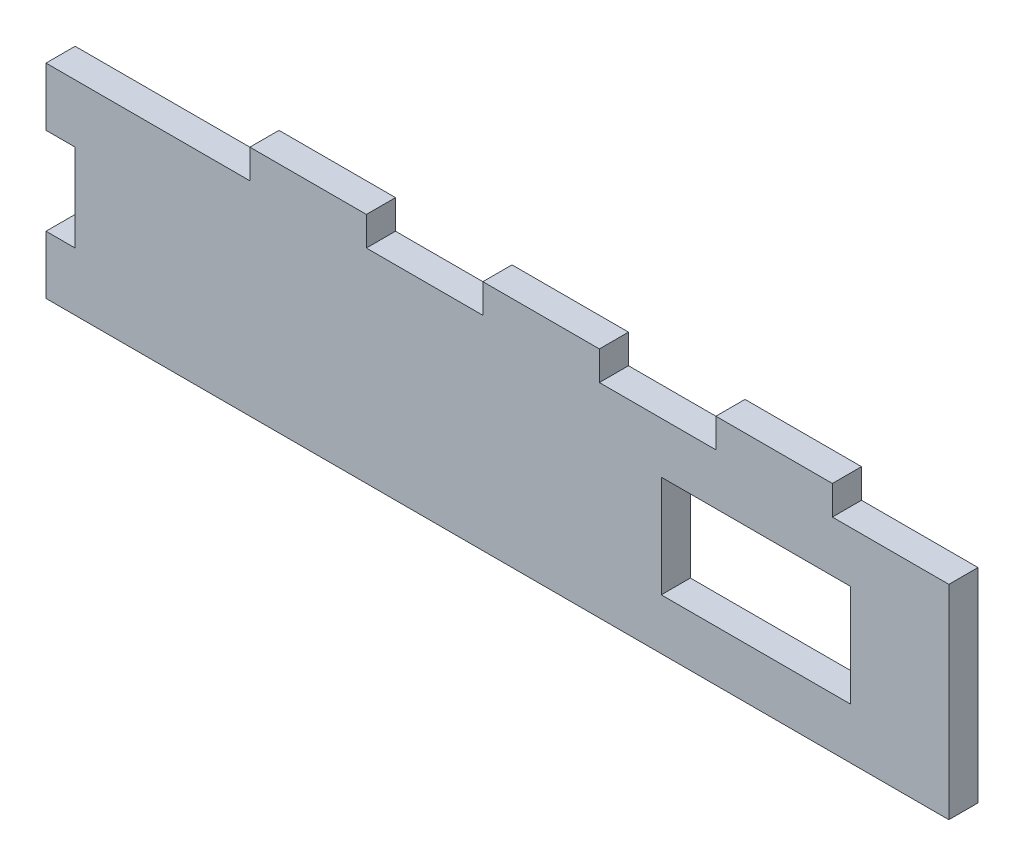
from build123d import *

# Parameters (mm, degrees)
SKETCH1_W           = 190.5
SKETCH1_H           = 44.45
BOSS_EXTRUDE1_DEPTH = 6.35
SKETCH2_W           = 41.275
SKETCH2_H           = 22.225
CUT_EXTRUDE1_DEPTH  = 151.221931202
SKETCH3_W           = 25.4
SKETCH3_H           = 6.35
BOSS_EXTRUDE2_DEPTH = 6.35
LPATTERN1_COUNT     = 3
LPATTERN1_PITCH     = 50.8
SKETCH4_W           = 6.35
SKETCH4_H           = 12.7
BOSS_EXTRUDE3_DEPTH = 6.35
LPATTERN2_COUNT     = 2
LPATTERN2_PITCH     = 31.75


with BuildPart() as part:
    # Sketch1 → Boss-Extrude1 (new body)
    with BuildSketch(Plane.XY):
        with Locations((-53.183, 0)):
            Rectangle(SKETCH1_W, SKETCH1_H)
    extrude(amount=BOSS_EXTRUDE1_DEPTH)

    # Sketch2 → Cut-Extrude1 (cut, through all)
    with BuildSketch(Plane.XY.offset(6.35)):
        Rectangle(SKETCH2_W, SKETCH2_H)
    extrude(amount=-CUT_EXTRUDE1_DEPTH, mode=Mode.SUBTRACT)

    # Sketch3 → Boss-Extrude2 (add)
    with BuildSketch(Plane(origin=(0, 22.225, 0), x_dir=(1, 0, 0), z_dir=(0, 1, 0))):
        with Locations((3.967, -3.175)):
            Rectangle(SKETCH3_W, SKETCH3_H)
    boss_extrude2 = extrude(amount=BOSS_EXTRUDE2_DEPTH)

    # LPattern1: Boss-Extrude2 ×3
    with Locations(*[(-i * LPATTERN1_PITCH, 0, 0) for i in range(1, LPATTERN1_COUNT)]):
        add(boss_extrude2)

    # Sketch4 → Boss-Extrude3 (add)
    with BuildSketch(Plane.ZY.offset(148.433)):
        with Locations((3.175, 15.875)):
            Rectangle(SKETCH4_W, SKETCH4_H)
    boss_extrude3 = extrude(amount=BOSS_EXTRUDE3_DEPTH)

    # LPattern2: Boss-Extrude3 ×2
    with Locations(*[(0, -i * LPATTERN2_PITCH, 0) for i in range(1, LPATTERN2_COUNT)]):
        add(boss_extrude3)


solid = part.part
